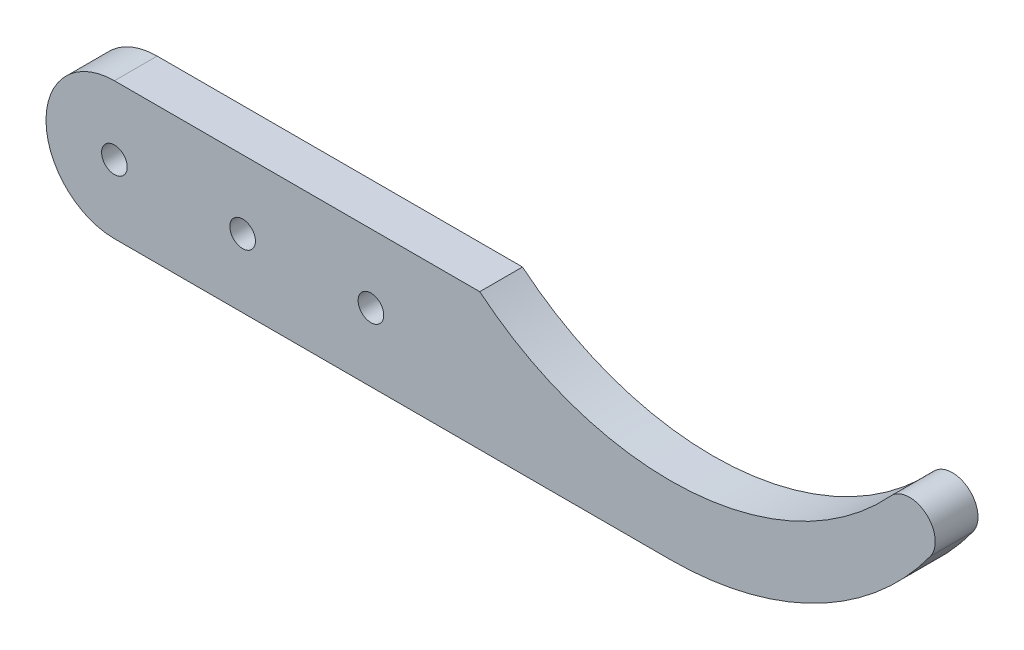
from build123d import *

# Parameters (mm, degrees)
ESQUISSE1_R        = 1.5
BOSS_EXTRU_1_DEPTH = 5


with BuildPart() as part:
    # Esquisse1 → Boss.-Extru.1 (new body)
    with BuildSketch(Plane.XY):
        with BuildLine():
            Line((0, 8), (20, 8))
            Line((20, 8), (27.728942549, 8))
            ThreePointArc((27.728942549, 8), (52.424855188, 0.084099935), (75.789473684, 11.33772946))
            ThreePointArc((75.789473684, 11.33772946), (79.896044345, 11.634403837), (80.431323149, 7.552074247))
            ThreePointArc((80.431323149, 7.552074247), (67.087513292, -3.886684877), (50, -8))
            Line((50, -8), (0, -8))
            Line((0, -8), (-15, -8))
            ThreePointArc((-15, -8), (-23, 0), (-15, 8))
            Line((-15, 8), (0, 8))
        make_face()
        Circle(ESQUISSE1_R, mode=Mode.SUBTRACT)
        with Locations((15, 0)):
            Circle(ESQUISSE1_R, mode=Mode.SUBTRACT)
        with Locations((-15, 0)):
            Circle(ESQUISSE1_R, mode=Mode.SUBTRACT)
    extrude(amount=BOSS_EXTRU_1_DEPTH)


solid = part.part
